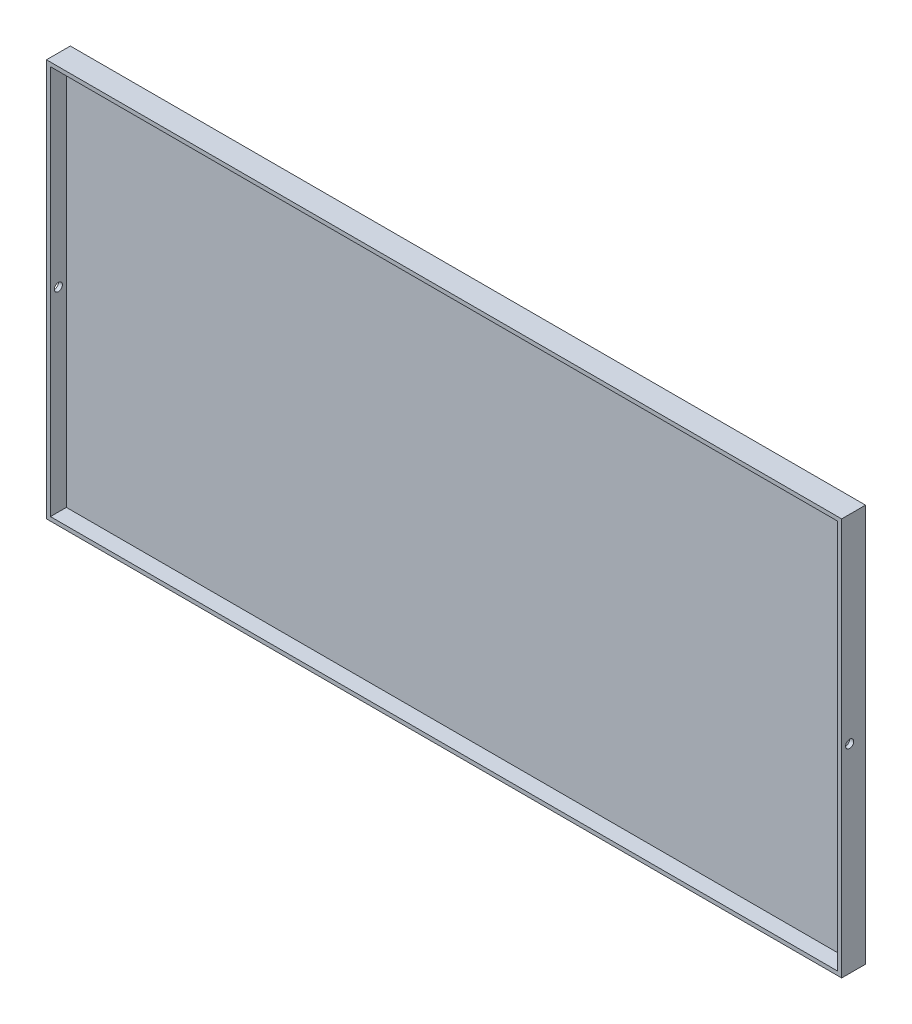
from build123d import *

# Parameters (mm, degrees)
SKETCH1_W           = 1000
SKETCH1_H           = 500
BOSS_EXTRUDE1_DEPTH = 20
SKETCH2_W           = 990
SKETCH2_H           = 490
CUT_EXTRUDE1_DEPTH  = 560.374650838
SKETCH4_R           = 5.08
CUT_EXTRUDE2_DEPTH  = 10
CUT_EXTRUDE3_START  = -10
SKETCH5_R           = 5.08
CUT_EXTRUDE3_DEPTH  = 10
SKETCH6_W           = 1000
SKETCH6_H           = 500
BOSS_EXTRUDE3_DEPTH = 10


with BuildPart() as part:
    # Sketch1 → Boss-Extrude1 (new body)
    with BuildSketch(Plane.XY):
        Rectangle(SKETCH1_W, SKETCH1_H)
    extrude(amount=BOSS_EXTRUDE1_DEPTH)

    # Sketch2 → Cut-Extrude1 (cut, through all)
    with BuildSketch(Plane.XY.offset(20)):
        Rectangle(SKETCH2_W, SKETCH2_H)
    extrude(amount=-CUT_EXTRUDE1_DEPTH, mode=Mode.SUBTRACT)

    # Sketch4 → Cut-Extrude2 (cut)
    with BuildSketch(Plane.ZY.offset(500)):
        with Locations((10, 0)):
            Circle(SKETCH4_R)
    extrude(amount=-CUT_EXTRUDE2_DEPTH, mode=Mode.SUBTRACT)

    # Sketch5 → Cut-Extrude3 (cut)
    with BuildSketch(Plane(origin=(500, 0, 0), x_dir=(0, 0, -1), z_dir=(1, 0, 0)).offset(CUT_EXTRUDE3_START)):
        with Locations((-10, 0)):
            Circle(SKETCH5_R)
    extrude(amount=CUT_EXTRUDE3_DEPTH, mode=Mode.SUBTRACT)

    # Sketch6 → Boss-Extrude3 (add)
    with BuildSketch(Plane.XY):
        Rectangle(SKETCH6_W, SKETCH6_H)
    extrude(amount=-BOSS_EXTRUDE3_DEPTH)


solid = part.part
